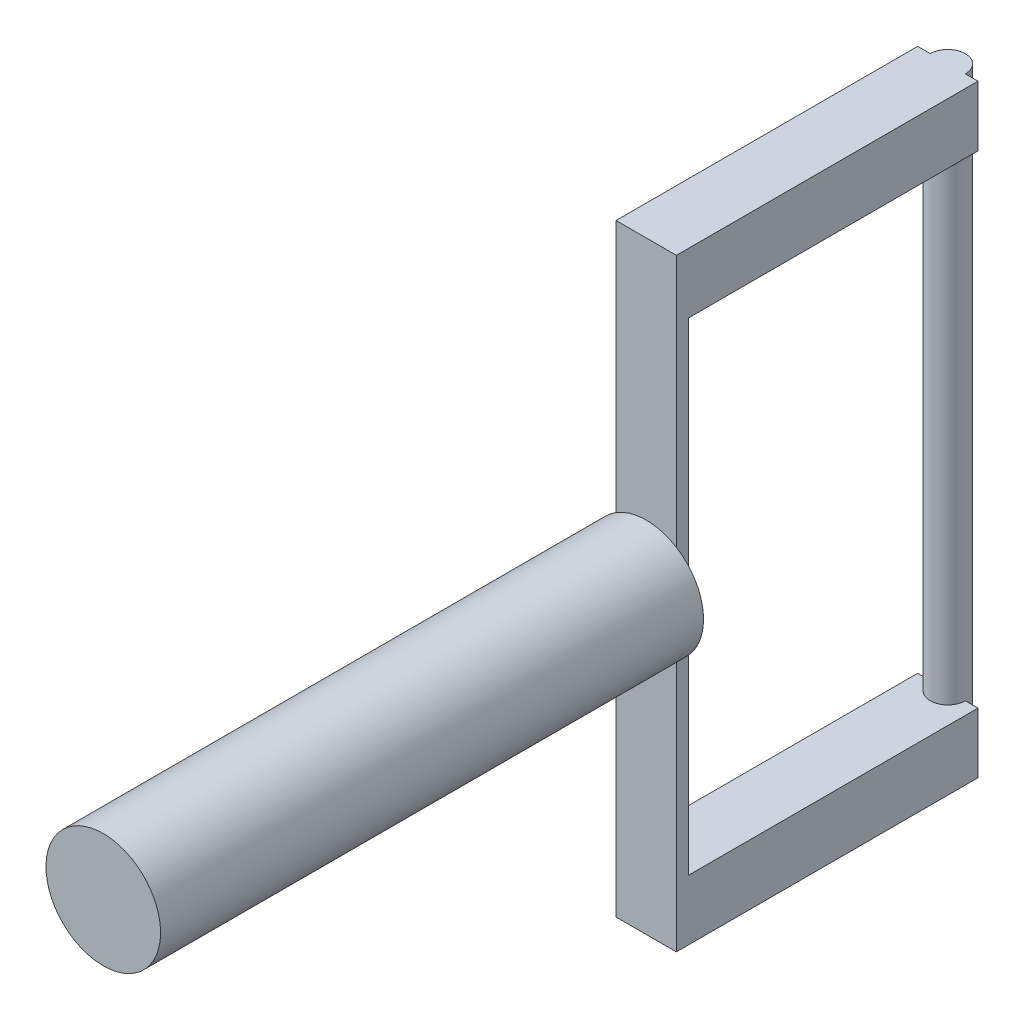
from build123d import *

# Parameters (mm, degrees)
SKETCH_1_R      = 0.29
EXTRUDE_1_DEPTH = 5
SKETCH_2_W      = 1
SKETCH_2_H      = 1
EXTRUDE_2_DEPTH = 5
SKETCH_3_W      = 1
SKETCH_3_H      = 8
EXTRUDE_3_DEPTH = 0.2
SKETCH_4_R      = 0.95
EXTRUDE_4_DEPTH = 9


with BuildPart() as part:
    # 草图1 → 凸台-拉伸1 (new, symmetric)
    with BuildSketch(Plane(origin=(0, 0, 0), x_dir=(1, 0, 0), z_dir=(0, 1, 0))):
        Circle(SKETCH_1_R)
    extrude(amount=EXTRUDE_1_DEPTH, both=True)

    # 草图2 → 凸台-拉伸2 (add)
    with BuildSketch(Plane.XY):
        with Locations((0, 4.5)):
            Rectangle(SKETCH_2_W, SKETCH_2_H)
        with Locations((0, -4.5)):
            Rectangle(SKETCH_2_W, SKETCH_2_H)
    extrude(amount=EXTRUDE_2_DEPTH)

    # 草图3 → 凸台-拉伸3 (add)
    with BuildSketch(Plane.XY.offset(5)):
        Rectangle(SKETCH_3_W, SKETCH_3_H)
    extrude(amount=-EXTRUDE_3_DEPTH)

    # 草图4 → 凸台-拉伸4 (add)
    with BuildSketch(Plane.XY.offset(5)):
        Circle(SKETCH_4_R)
    extrude(amount=EXTRUDE_4_DEPTH)


solid = part.part
